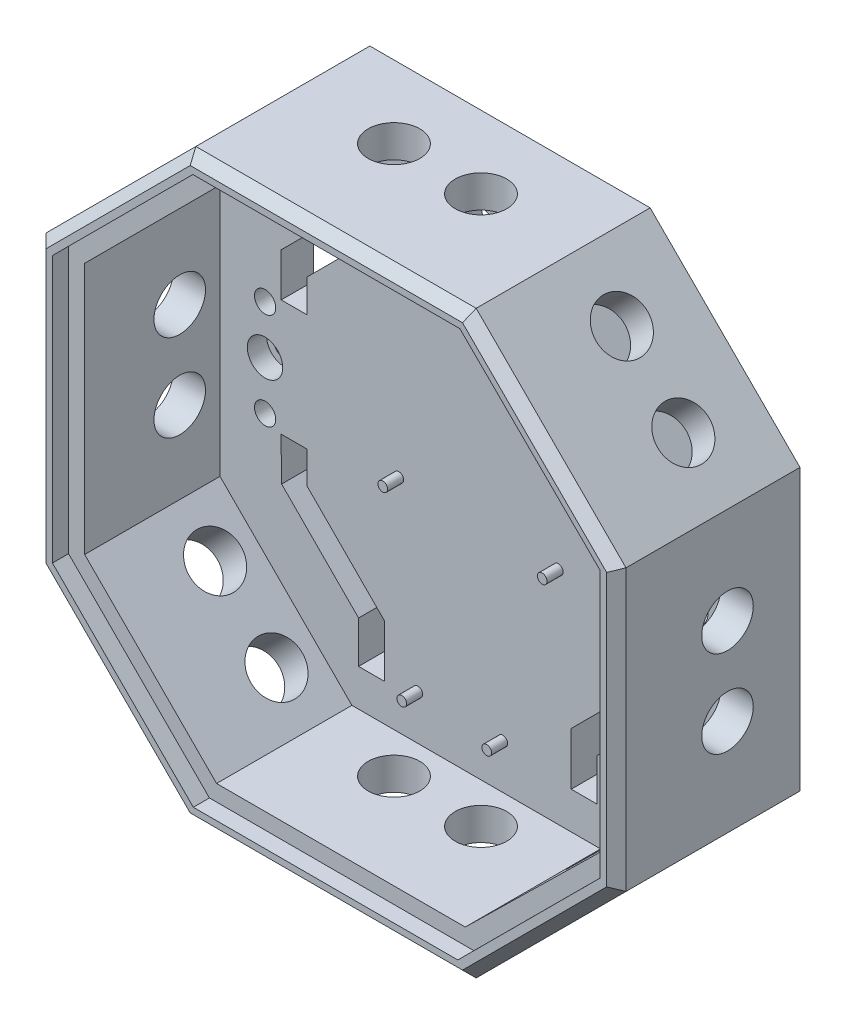
from build123d import *

# Parameters (mm, degrees)
ESBO_O12_R                        = 3.3
ESBO_O12_R_2                      = 9
RESSALTO_EXTRUS_O4_DEPTH          = 10
RESSALTO_EXTRUS_O5_DEPTH          = 47
ESBO_O17_R                        = 8
CORTE_EXTRUS_O2_DEPTH             = 210
ESBO_O18_R                        = 8
CORTE_EXTRUS_O3_DEPTH             = 210
ESBO_O19_R                        = 8
CORTE_EXTRUS_O4_DEPTH             = 210
ESBO_O20_R                        = 8
CORTE_EXTRUS_O5_DEPTH             = 210
ESBO_O34_R                        = 3
CORTE_EXTRUS_O6_DEPTH             = 10
ESBO_O31_R                        = 1.5
ESBO_O31_R_2                      = 1.498317916
RESSALTO_EXTRUS_O6_DEPTH          = 5
CORTE_EXTRUS_O26_DEPTH            = 5
CHANFRO1_SIZE                     = 3
REBAIXO_PARA_SHCS_M61_D           = 6.6
REBAIXO_PARA_SHCS_M61_CBORE_D     = 11
REBAIXO_PARA_SHCS_M61_CBORE_DEPTH = 6
REBAIXO_PARA_SHCS_M62_D           = 6.6
REBAIXO_PARA_SHCS_M62_CBORE_D     = 11
REBAIXO_PARA_SHCS_M62_CBORE_DEPTH = 6


with BuildPart() as part:
    # Esboço12 → Ressalto-extrusão4 (new body)
    with BuildSketch(Plane.XY):
        Polygon((-43.442019909, 89.992833098), (43.547358529, 89.992833098), (90.051531654, 43.488589101), (90.051531654, -43.502993777), (43.547287656, -90.007166902), (-43.442090786, -90.007166902), (-89.948468346, -43.500718464), (-89.948468346, 43.486455538), align=None)
        with Locations((66.051531654, 14.992833098)):
            Circle(ESBO_O12_R, mode=Mode.SUBTRACT)
        with Locations((66.051531654, -15.007166902)):
            Circle(ESBO_O12_R, mode=Mode.SUBTRACT)
        with Locations((-65.948468346, 14.992833098)):
            Circle(ESBO_O12_R, mode=Mode.SUBTRACT)
        with Locations((-65.948468346, -15.007166902)):
            Circle(ESBO_O12_R, mode=Mode.SUBTRACT)
        with Locations((0.051531654, 64.992833098)):
            Circle(ESBO_O12_R_2, mode=Mode.SUBTRACT)
        Polygon((-60.948468346, 31.474249285), (-31.429839545, 60.992833098), (-17.949839545, 60.992833098), (-17.949839545, 52.992833098), (-28.114859268, 52.992833098), (-52.948468346, 28.159261867), (-52.948468346, 17.994249285), (-60.948468346, 17.994249285), align=None, mode=Mode.SUBTRACT)
        Polygon((53.051531654, 17.992151326), (53.051531654, 28.157190374), (28.217922524, 52.990761555), (18.050160455, 52.990761555), (18.050160455, 60.994293606), (31.530155448, 61.005911117), (61.051531654, 31.484580025), (61.051531654, 17.992151326), align=None, mode=Mode.SUBTRACT)
        Polygon((53.131887897, -18.091006566), (61.131887897, -18.091008785), (61.10468272, -31.437636538), (37.051531654, -55.490750947), (37.051531654, -58.337648525), (37.051531654, -68.507166902), (29.051531654, -68.507166902), (29.051531654, -55.027166902), (29.051531654, -52.177038877), (53.131887897, -28.096719332), align=None, mode=Mode.SUBTRACT)
        Polygon((-52.948468346, -18.091006566), (-52.948468346, -28.017525688), (-28.948468346, -52.194216601), (-28.948468346, -55.027166902), (-28.948468346, -68.507166902), (-36.948468346, -68.507166902), (-36.948468346, -58.337166902), (-36.948468346, -55.490750947), (-60.825794978, -31.437636538), (-61.022458263, -18.092366368), align=None, mode=Mode.SUBTRACT)
    extrude(amount=RESSALTO_EXTRUS_O4_DEPTH)

    # Esboço16 → Ressalto-extrusão5 (add)
    with BuildSketch(Plane.XY.offset(10)):
        Polygon((-89.948468346, -43.500718464), (-89.948468346, 43.486455538), (-43.442019909, 89.992833098), (43.547358529, 89.992833098), (90.051531654, 43.488589101), (90.051531654, -43.502993777), (43.547287656, -90.007166902), (-43.442090786, -90.007166902), align=None)
        Polygon((80.051531654, 38.223450644), (80.051531654, -38.929821575), (38.153449229, -80.007166902), (-39.014746926, -80.007166902), (-79.948468346, -38.929821575), (-79.943302965, 39.349480824), (-39.299888749, 79.992833098), (39.413282668, 79.992833098), (80.051531654, 39.354646214), align=None, mode=Mode.SUBTRACT)
    extrude(amount=RESSALTO_EXTRUS_O5_DEPTH)

    # Esboço17 → Corte-extrusão2 (cut)
    with BuildSketch(Plane(origin=(0, -90.007166902, 0), x_dir=(-1, 0, 0), z_dir=(0, -1, 0))):
        with Locations((13.452090786, -22.5)):
            Circle(ESBO_O17_R)
        with Locations((-13.547909214, -22.5)):
            Circle(ESBO_O17_R)
    extrude(amount=-CORTE_EXTRUS_O2_DEPTH, mode=Mode.SUBTRACT)

    # Esboço18 → Corte-extrusão3 (cut)
    with BuildSketch(Plane(origin=(66.777194095, -66.777295865, 0), x_dir=(0, 0, -1), z_dir=(0.7071062423620708, -0.7071073200106138, 0))):
        with Locations((-22.5, 13.524858749)):
            Circle(ESBO_O18_R)
        with Locations((-22.5, -13.475141251)):
            Circle(ESBO_O18_R)
    extrude(amount=-CORTE_EXTRUS_O3_DEPTH, mode=Mode.SUBTRACT)

    # Esboço19 → Corte-extrusão4 (cut)
    with BuildSketch(Plane(origin=(-66.724661947, -66.724560257, 0), x_dir=(0.7071062423620708, -0.7071073200106138, 0), z_dir=(-0.7071073200106138, -0.7071062423620708, 0))):
        with Locations((-13.453447007, 22.5)):
            Circle(ESBO_O19_R)
        with Locations((13.546552993, 22.5)):
            Circle(ESBO_O19_R)
    extrude(amount=-CORTE_EXTRUS_O4_DEPTH, mode=Mode.SUBTRACT)

    # Esboço20 → Corte-extrusão5 (cut)
    with BuildSketch(Plane(origin=(90.051531654, 0, 0), x_dir=(0, 0, -1), z_dir=(1, 0, 0))):
        with Locations((-22.5, 13.498589101)):
            Circle(ESBO_O20_R)
        with Locations((-22.5, -13.501410899)):
            Circle(ESBO_O20_R)
    extrude(amount=-CORTE_EXTRUS_O5_DEPTH, mode=Mode.SUBTRACT)

    # Esboço34 → Corte-extrusão6 (cut)
    with BuildSketch(Plane.XY.offset(10)):
        with Locations((-65.982720665, 0)):
            Circle(ESBO_O34_R)
        with Locations((66.021398917, 0)):
            Circle(ESBO_O34_R)
    extrude(amount=-CORTE_EXTRUS_O6_DEPTH, mode=Mode.SUBTRACT)

    # Esboço31 → Ressalto-extrusão6 (add)
    with BuildSketch(Plane.XY.offset(10)):
        with Locations((-24.448468346, -11.407166902)):
            Circle(ESBO_O31_R)
        with Locations((25.051531654, -11.407166902)):
            Circle(ESBO_O31_R)
        with Locations((-18.548468346, -66.106471206)):
            Circle(ESBO_O31_R)
        with Locations((7.831531644, -66.107166902)):
            Circle(ESBO_O31_R_2)
    extrude(amount=RESSALTO_EXTRUS_O6_DEPTH)

    # Esboço62 → Corte-extrusão26 (cut)
    with BuildSketch(Plane.XY.offset(57)):
        Polygon((-84.948468346, 41.420550876), (-41.375901555, 84.98788588), (41.480320599, 84.992833098), (85.051531654, 41.758918558), (85.051531654, -40.878522547), (40.850368442, -85.007166902), (-41.228418856, -85.007166902), (-84.948468346, -41.215270019), align=None)
        Polygon((39.413282668, 79.992833098), (80.051531654, 39.354646214), (80.051531654, -38.929821575), (38.153449229, -80.007166902), (-39.014746926, -80.007166902), (-79.948468346, -38.929821575), (-79.943302965, 39.349480824), (-39.299888749, 79.992833098), align=None, mode=Mode.SUBTRACT)
    extrude(amount=-CORTE_EXTRUS_O26_DEPTH, mode=Mode.SUBTRACT)

    # Chanfro1
    chanfro1_edges = [part.edges().sort_by_distance(p)[0] for p in [
        (-66.695244128, 66.739644318, 57),
        (-89.948468346, -0.007131463, 57),
        (-66.695279566, -66.753942683, 57),
        (0.052598435, -90.007166902, 57),
        (66.799409655, -66.755080339, 57),
        (90.051531654, -0.007202338, 57),
        (66.799445092, 66.7407111, 57),
        (0.05266931, 89.992833098, 57),
    ]]
    chamfer(chanfro1_edges, length=CHANFRO1_SIZE)

    # Rebaixo para SHCS M61 (through all)
    with Locations(Plane(origin=(-65.982720665, 0, 10), x_dir=(1, 0, 0), z_dir=(0, 0, 1))):
        with Locations((0, 0)):
            CounterBoreHole(REBAIXO_PARA_SHCS_M61_D / 2, REBAIXO_PARA_SHCS_M61_CBORE_D / 2, REBAIXO_PARA_SHCS_M61_CBORE_DEPTH)

    # Rebaixo para SHCS M62 (through all)
    with Locations(Plane(origin=(66.021398917, 0, 10), x_dir=(1, 0, 0), z_dir=(0, 0, 1))):
        with Locations((0, 0)):
            CounterBoreHole(REBAIXO_PARA_SHCS_M62_D / 2, REBAIXO_PARA_SHCS_M62_CBORE_D / 2, REBAIXO_PARA_SHCS_M62_CBORE_DEPTH)


solid = part.part
